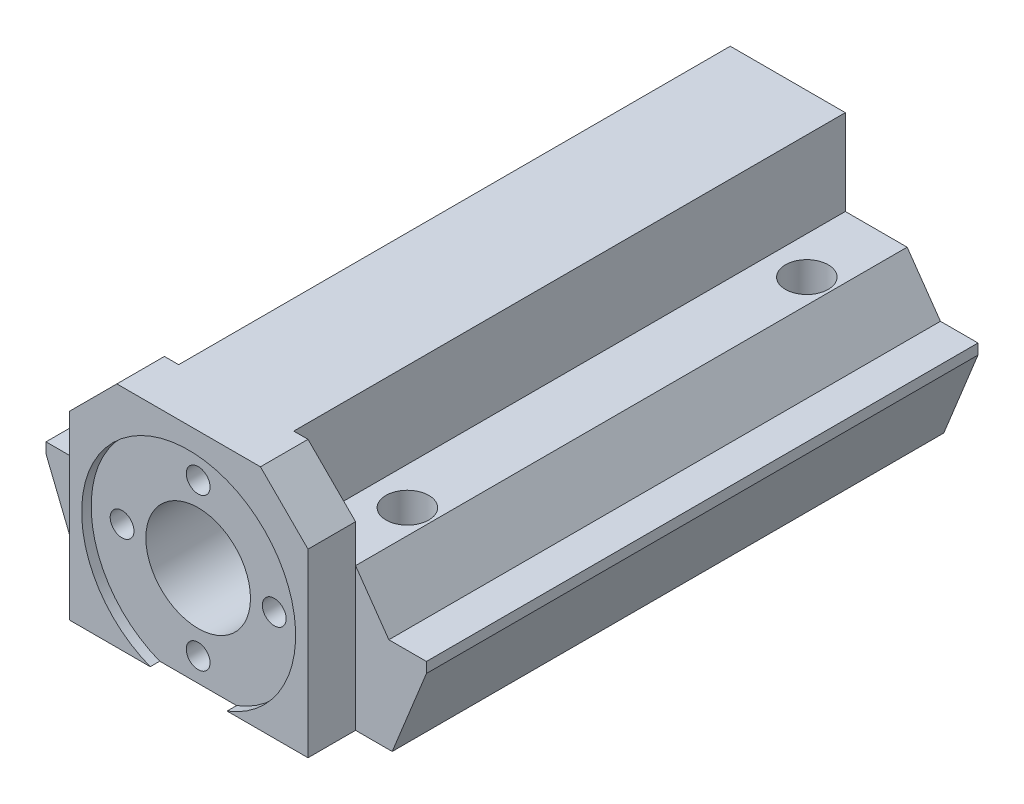
from build123d import *
from OCP.BRepFilletAPI import BRepFilletAPI_MakeChamfer

# Parameters (mm, degrees)
BOSS_EXTRUDE1_DEPTH = 58
SKETCH11_W          = 40
SKETCH11_H          = 11
BOSS_EXTRUDE3_DEPTH = 58
SKETCH5_W           = 25.1
SKETCH5_H           = 25
BOSS_EXTRUDE2_DEPTH = 5
SKETCH6_R           = 5.5
CUT_EXTRUDE4_DEPTH  = 63
SKETCH7_R           = 11.25
CUT_EXTRUDE5_DEPTH  = 1
SKETCH10_R          = 2.25
CUT_EXTRUDE7_DEPTH  = 16
CHAMFER2_SIZE       = 5
SKETCH9_R           = 1.25
CUT_EXTRUDE8_DEPTH  = 10
CUT_EXTRUDE9_DEPTH  = 8
CHAMFER4_SIZE       = 2
CHAMFER6_SIZE       = 5
CHAMFER6_SIZE_2     = 3.501037691
CHAMFER7_SIZE       = 4
CHAMFER7_SIZE2      = 9.900347414
CHAMFER8_SIZE       = 4
CHAMFER8_SIZE2      = 9.900347414
SKETCH13_W          = 40
SKETCH13_H          = 2
CUT_EXTRUDE10_DEPTH = 67


# Some blends are built 0.0001 mm under size
with BuildPart() as part:
    # Sketch1 → Boss-Extrude1 (new body)
    with BuildSketch(Plane.XY):
        Polygon((-6.05, 25), (6.05, 25), (6.05, 16), (12.55, 16), (12.55, 0), (-12.55, 0), (-12.55, 16), (-6.05, 16), align=None)
    extrude(amount=BOSS_EXTRUDE1_DEPTH)

    # Sketch11 → Boss-Extrude3 (add)
    with BuildSketch(Plane(origin=(0, 0, 0), x_dir=(-1, 0, 0), z_dir=(0, 0, -1))):
        with Locations((0, 5.5)):
            Rectangle(SKETCH11_W, SKETCH11_H)
    extrude(amount=-BOSS_EXTRUDE3_DEPTH)

    # Sketch5 → Boss-Extrude2 (add)
    with BuildSketch(Plane.XY.offset(58)):
        with Locations((0, 12.5)):
            Rectangle(SKETCH5_W, SKETCH5_H)
    extrude(amount=BOSS_EXTRUDE2_DEPTH)

    # Sketch6 → Cut-Extrude4 (cut)
    with BuildSketch(Plane(origin=(0, 0, 0), x_dir=(-1, 0, 0), z_dir=(0, 0, -1))):
        with Locations((0, 11.5)):
            Circle(SKETCH6_R)
    extrude(amount=-CUT_EXTRUDE4_DEPTH, mode=Mode.SUBTRACT)

    # Sketch7 → Cut-Extrude5 (cut)
    with BuildSketch(Plane.XY.offset(63)):
        with Locations((0, 11.5)):
            Circle(SKETCH7_R)
    extrude(amount=-CUT_EXTRUDE5_DEPTH, mode=Mode.SUBTRACT)

    # Sketch10 → Cut-Extrude7 (cut)
    with BuildSketch(Plane(origin=(0, 16, 0), x_dir=(1, 0, 0), z_dir=(0, 1, 0))):
        with Locations(Location((-10, -8, 0), (0, 0, 270))):
            Circle(SKETCH10_R)
        with Locations(Location((-10, -50, 0), (0, 0, 270))):
            Circle(SKETCH10_R)
        with Locations(Location((10, -50, 0), (0, 0, 270))):
            Circle(SKETCH10_R)
        with Locations(Location((10, -8, 0), (0, 0, 270))):
            Circle(SKETCH10_R)
    extrude(amount=-CUT_EXTRUDE7_DEPTH, mode=Mode.SUBTRACT)

    # Chamfer2
    chamfer2_edges = [part.edges().sort_by_distance(p)[0] for p in [
        (-12.55, 25, 60.5),
        (12.55, 25, 60.5),
    ]]
    chamfer(chamfer2_edges, length=CHAMFER2_SIZE)

    # Sketch9 → Cut-Extrude8 (cut)
    with BuildSketch(Plane.XY.offset(62)):
        with Locations((-8, 11.5)):
            Circle(SKETCH9_R)
        with Locations((8, 11.5)):
            Circle(SKETCH9_R)
        with Locations((0, 3.5)):
            Circle(SKETCH9_R)
        with Locations((0, 19.5)):
            Circle(SKETCH9_R)
    extrude(amount=-CUT_EXTRUDE8_DEPTH, mode=Mode.SUBTRACT)

    # Sketch12 → Cut-Extrude9 (cut)
    with BuildSketch(Plane.XZ):
        Polygon((12.165063509, 46.25), (14.330127019, 50), (12.165063509, 53.75), (7.834936491, 53.75), (5.669872981, 50), (7.834936491, 46.25), align=None)
        Polygon((-7.834936491, 46.25), (-5.669872981, 50), (-7.834936491, 53.75), (-12.165063509, 53.75), (-14.330127019, 50), (-12.165063509, 46.25), align=None)
        Polygon((-7.834936491, 4.25), (-5.669872981, 8), (-7.834936491, 11.75), (-12.165063509, 11.75), (-14.330127019, 8), (-12.165063509, 4.25), align=None)
        Polygon((12.165063509, 4.25), (14.330127019, 8), (12.165063509, 11.75), (7.834936491, 11.75), (5.669872981, 8), (7.834936491, 4.25), align=None)
    extrude(amount=-CUT_EXTRUDE9_DEPTH, mode=Mode.SUBTRACT)

    # Chamfer4
    # the kernel refuses this chamfer: 2 mm, written as the material it adds along each edge
    with BuildSketch(Plane(origin=(-16.901810007, 8, 12.454285596), x_dir=(-0.023812127644090745, -0.9996219169112968, -0.013747938305293514), z_dir=(0.49999999999999983, 0, -0.8660254037844388))) as chamfer4_piece_1_section:
        Polygon((CHAMFER4_SIZE * 0.999621916911, -CHAMFER4_SIZE * 0.0274958766106), (-CHAMFER4_SIZE * 0.0274958766106, -CHAMFER4_SIZE * 0.999621916911), (0, 0), align=None)
    chamfer4_piece_1 = extrude(amount=14.616858971, mode=Mode.PRIVATE)
    chamfer4_piece_1 = chamfer4_piece_1 - Plane(origin=(-10, 7.348778849, 8), x_dir=(0, 0, 1), z_dir=(0, 1, 0)) * Cylinder(2.25, 38, mode=Mode.PRIVATE)
    chamfer4_piece_1 = split(chamfer4_piece_1, bisect_by=Plane(origin=(-12.643492577, 7.348778849, 4.25), z_dir=(0, 0, 1)), keep=Keep.TOP, mode=Mode.PRIVATE)
    add(chamfer4_piece_1)
    with BuildSketch(Plane(origin=(-9.593380521, 8, 16.204285596), x_dir=(-0.02381212764408972, -0.9996219169112968, 0.013747938305292926), z_dir=(-0.49999999999999994, 0, -0.8660254037844387))) as chamfer4_piece_2_section:
        Polygon((CHAMFER4_SIZE * 0.999621916911, -CHAMFER4_SIZE * 0.0274958766106), (-CHAMFER4_SIZE * 0.0274958766106, -CHAMFER4_SIZE * 0.999621916911), (0, 0), align=None)
    chamfer4_piece_2 = extrude(amount=14.616858971, mode=Mode.PRIVATE)
    chamfer4_piece_2 = chamfer4_piece_2 - Plane(origin=(-10, 7.348778849, 8), x_dir=(0, 0, 1), z_dir=(0, 1, 0)) * Cylinder(2.25, 38, mode=Mode.PRIVATE)
    add(chamfer4_piece_2)
    with BuildSketch(Plane(origin=(-2.691570515, 8, 11.75), x_dir=(0, -0.9996219169112968, 0.027495876610586487), z_dir=(-1, 0, 0))) as chamfer4_piece_3_section:
        Polygon((CHAMFER4_SIZE * 0.999621916911, -CHAMFER4_SIZE * 0.0274958766106), (-CHAMFER4_SIZE * 0.0274958766106, -CHAMFER4_SIZE * 0.999621916911), (0, 0), align=None)
    chamfer4_piece_3 = extrude(amount=14.616858971, mode=Mode.PRIVATE)
    chamfer4_piece_3 = chamfer4_piece_3 - Plane(origin=(-10, 7.348778849, 8), x_dir=(0, 0, 1), z_dir=(0, 1, 0)) * Cylinder(2.25, 38, mode=Mode.PRIVATE)
    chamfer4_piece_3 = split(chamfer4_piece_3, bisect_by=Plane(origin=(-8.074151024, 7.348778849, 12.164331727), z_dir=(-0.8660254037844387, 0, -0.49999999999999994)), keep=Keep.TOP, mode=Mode.PRIVATE)
    add(chamfer4_piece_3)
    with BuildSketch(Plane(origin=(-3.098189993, 8, 3.545714404), x_dir=(0.023812127644090235, -0.9996219169112968, 0.01374793830529322), z_dir=(-0.49999999999999994, 0, 0.8660254037844387))) as chamfer4_piece_4_section:
        Polygon((CHAMFER4_SIZE * 0.999621916911, -CHAMFER4_SIZE * 0.0274958766106), (-CHAMFER4_SIZE * 0.0274958766106, -CHAMFER4_SIZE * 0.999621916911), (0, 0), align=None)
    chamfer4_piece_4 = extrude(amount=14.616858971, mode=Mode.PRIVATE)
    chamfer4_piece_4 = chamfer4_piece_4 - Plane(origin=(-10, 7.348778849, 8), x_dir=(0, 0, 1), z_dir=(0, 1, 0)) * Cylinder(2.25, 38, mode=Mode.PRIVATE)
    chamfer4_piece_4 = split(chamfer4_piece_4, bisect_by=Plane(origin=(-5.430658447, 7.348778849, 8.414331727), z_dir=(-0.8660254037844387, 0, 0.4999999999999999)), keep=Keep.TOP, mode=Mode.PRIVATE)
    add(chamfer4_piece_4)
    with BuildSketch(Plane(origin=(-10.406619479, 8, -0.204285596), x_dir=(0.023812127644089884, -0.9996219169112968, -0.013747938305293021), z_dir=(0.4999999999999999, 0, 0.8660254037844387))) as chamfer4_piece_5_section:
        Polygon((CHAMFER4_SIZE * 0.999621916911, -CHAMFER4_SIZE * 0.0274958766106), (-CHAMFER4_SIZE * 0.0274958766106, -CHAMFER4_SIZE * 0.999621916911), (0, 0), align=None)
    chamfer4_piece_5 = extrude(amount=14.616858971, mode=Mode.PRIVATE)
    chamfer4_piece_5 = chamfer4_piece_5 - Plane(origin=(-10, 7.348778849, 8), x_dir=(0, 0, 1), z_dir=(0, 1, 0)) * Cylinder(2.25, 38, mode=Mode.PRIVATE)
    chamfer4_piece_5 = split(chamfer4_piece_5, bisect_by=Plane(origin=(-5.430658447, 7.348778849, 7.585668273), z_dir=(-0.8660254037844387, 0, -0.49999999999999994)), keep=Keep.TOP, mode=Mode.PRIVATE)
    chamfer4_piece_5 = split(chamfer4_piece_5, bisect_by=Plane(origin=(-7.356507423, 7.348778849, 4.25), z_dir=(0, 0, 1)), keep=Keep.TOP, mode=Mode.PRIVATE)
    add(chamfer4_piece_5)
    with BuildSketch(Plane(origin=(-17.308429485, 8, 4.25), x_dir=(0, -0.9996219169112968, -0.027495876610586487), z_dir=(1, 0, 0))) as chamfer4_piece_6_section:
        Polygon((CHAMFER4_SIZE * 0.999621916911, -CHAMFER4_SIZE * 0.0274958766106), (-CHAMFER4_SIZE * 0.0274958766106, -CHAMFER4_SIZE * 0.999621916911), (0, 0), align=None)
    chamfer4_piece_6 = extrude(amount=14.616858971, mode=Mode.PRIVATE)
    chamfer4_piece_6 = chamfer4_piece_6 - Plane(origin=(-10, 7.348778849, 8), x_dir=(0, 0, 1), z_dir=(0, 1, 0)) * Cylinder(2.25, 38, mode=Mode.PRIVATE)
    chamfer4_piece_6 = split(chamfer4_piece_6, bisect_by=Plane(origin=(-8.074151024, 7.348778849, 3.835668273), z_dir=(-0.8660254037844387, 0, 0.4999999999999999)), keep=Keep.TOP, mode=Mode.PRIVATE)
    add(chamfer4_piece_6)
    with BuildSketch(Plane(origin=(3.098189993, 8, 12.454285596), x_dir=(-0.023812127644090207, -0.9996219169112968, -0.013747938305293207), z_dir=(0.49999999999999994, 0, -0.8660254037844387))) as chamfer4_piece_7_section:
        Polygon((CHAMFER4_SIZE * 0.999621916911, -CHAMFER4_SIZE * 0.0274958766106), (-CHAMFER4_SIZE * 0.0274958766106, -CHAMFER4_SIZE * 0.999621916911), (0, 0), align=None)
    chamfer4_piece_7 = extrude(amount=14.616858971, mode=Mode.PRIVATE)
    chamfer4_piece_7 = split(chamfer4_piece_7, bisect_by=Plane(origin=(5.430658447, 7.348778849, 7.585668273), z_dir=(0.8660254037844387, 0, -0.49999999999999994)), keep=Keep.TOP, mode=Mode.PRIVATE)
    chamfer4_piece_7 = split(chamfer4_piece_7, bisect_by=Plane(origin=(7.356507423, 7.348778849, 4.25), z_dir=(0, 0, 1)), keep=Keep.TOP, mode=Mode.PRIVATE)
    chamfer4_piece_7 = chamfer4_piece_7 - Plane(origin=(10, 7.348778849, 8), x_dir=(0, 0, 1), z_dir=(0, 1, 0)) * Cylinder(2.25, 38, mode=Mode.PRIVATE)
    add(chamfer4_piece_7)
    with BuildSketch(Plane(origin=(10.406619479, 8, 16.204285596), x_dir=(-0.023812127644090367, -0.9996219169112968, 0.0137479383052933), z_dir=(-0.49999999999999994, 0, -0.8660254037844387))) as chamfer4_piece_8_section:
        Polygon((CHAMFER4_SIZE * 0.999621916911, -CHAMFER4_SIZE * 0.0274958766106), (-CHAMFER4_SIZE * 0.0274958766106, -CHAMFER4_SIZE * 0.999621916911), (0, 0), align=None)
    chamfer4_piece_8 = extrude(amount=14.616858971, mode=Mode.PRIVATE)
    chamfer4_piece_8 = split(chamfer4_piece_8, bisect_by=Plane(origin=(5.430658447, 7.348778849, 8.414331727), z_dir=(0.8660254037844387, 0, 0.49999999999999994)), keep=Keep.TOP, mode=Mode.PRIVATE)
    chamfer4_piece_8 = chamfer4_piece_8 - Plane(origin=(10, 7.348778849, 8), x_dir=(0, 0, 1), z_dir=(0, 1, 0)) * Cylinder(2.25, 38, mode=Mode.PRIVATE)
    add(chamfer4_piece_8)
    with BuildSketch(Plane(origin=(17.308429485, 8, 11.75), x_dir=(0, -0.9996219169112968, 0.027495876610586487), z_dir=(-1, 0, 0))) as chamfer4_piece_9_section:
        Polygon((CHAMFER4_SIZE * 0.999621916911, -CHAMFER4_SIZE * 0.0274958766106), (-CHAMFER4_SIZE * 0.0274958766106, -CHAMFER4_SIZE * 0.999621916911), (0, 0), align=None)
    chamfer4_piece_9 = extrude(amount=14.616858971, mode=Mode.PRIVATE)
    chamfer4_piece_9 = split(chamfer4_piece_9, bisect_by=Plane(origin=(8.074151024, 7.348778849, 12.164331727), z_dir=(0.8660254037844387, 0, -0.49999999999999994)), keep=Keep.TOP, mode=Mode.PRIVATE)
    chamfer4_piece_9 = chamfer4_piece_9 - Plane(origin=(10, 7.348778849, 8), x_dir=(0, 0, 1), z_dir=(0, 1, 0)) * Cylinder(2.25, 38, mode=Mode.PRIVATE)
    add(chamfer4_piece_9)
    with BuildSketch(Plane(origin=(16.901810007, 8, 3.545714404), x_dir=(0.02381212764409056, -0.9996219169112968, 0.013747938305293401), z_dir=(-0.49999999999999967, 0, 0.8660254037844388))) as chamfer4_piece_10_section:
        Polygon((CHAMFER4_SIZE * 0.999621916911, -CHAMFER4_SIZE * 0.0274958766106), (-CHAMFER4_SIZE * 0.0274958766106, -CHAMFER4_SIZE * 0.999621916911), (0, 0), align=None)
    chamfer4_piece_10 = extrude(amount=14.616858971, mode=Mode.PRIVATE)
    chamfer4_piece_10 = chamfer4_piece_10 - Plane(origin=(10, 7.348778849, 8), x_dir=(0, 0, 1), z_dir=(0, 1, 0)) * Cylinder(2.25, 38, mode=Mode.PRIVATE)
    add(chamfer4_piece_10)
    with BuildSketch(Plane(origin=(9.593380521, 8, -0.204285596), x_dir=(0.02381212764408988, -0.9996219169112968, -0.01374793830529301), z_dir=(0.49999999999999967, 0, 0.8660254037844388))) as chamfer4_piece_11_section:
        Polygon((CHAMFER4_SIZE * 0.999621916911, -CHAMFER4_SIZE * 0.0274958766106), (-CHAMFER4_SIZE * 0.0274958766106, -CHAMFER4_SIZE * 0.999621916911), (0, 0), align=None)
    chamfer4_piece_11 = extrude(amount=14.616858971, mode=Mode.PRIVATE)
    chamfer4_piece_11 = split(chamfer4_piece_11, bisect_by=Plane(origin=(12.643492577, 7.348778849, 4.25), z_dir=(0, 0, 1)), keep=Keep.TOP, mode=Mode.PRIVATE)
    chamfer4_piece_11 = chamfer4_piece_11 - Plane(origin=(10, 7.348778849, 8), x_dir=(0, 0, 1), z_dir=(0, 1, 0)) * Cylinder(2.25, 38, mode=Mode.PRIVATE)
    add(chamfer4_piece_11)
    with BuildSketch(Plane(origin=(2.691570515, 8, 4.25), x_dir=(0, -0.9996219169112968, -0.027495876610586487), z_dir=(1, 0, 0))) as chamfer4_piece_12_section:
        Polygon((CHAMFER4_SIZE * 0.999621916911, -CHAMFER4_SIZE * 0.0274958766106), (-CHAMFER4_SIZE * 0.0274958766106, -CHAMFER4_SIZE * 0.999621916911), (0, 0), align=None)
    chamfer4_piece_12 = extrude(amount=14.616858971, mode=Mode.PRIVATE)
    chamfer4_piece_12 = split(chamfer4_piece_12, bisect_by=Plane(origin=(8.074151024, 7.348778849, 3.835668273), z_dir=(0.8660254037844387, 0, 0.49999999999999994)), keep=Keep.TOP, mode=Mode.PRIVATE)
    chamfer4_piece_12 = chamfer4_piece_12 - Plane(origin=(10, 7.348778849, 8), x_dir=(0, 0, 1), z_dir=(0, 1, 0)) * Cylinder(2.25, 38, mode=Mode.PRIVATE)
    add(chamfer4_piece_12)
    with BuildSketch(Plane(origin=(3.098189993, 8, 54.454285596), x_dir=(-0.02381212764409011, -0.9996219169112968, -0.013747938305293146), z_dir=(0.4999999999999998, 0, -0.8660254037844388))) as chamfer4_piece_13_section:
        Polygon((CHAMFER4_SIZE * 0.999621916911, -CHAMFER4_SIZE * 0.0274958766106), (-CHAMFER4_SIZE * 0.0274958766106, -CHAMFER4_SIZE * 0.999621916911), (0, 0), align=None)
    chamfer4_piece_13 = extrude(amount=14.616858971, mode=Mode.PRIVATE)
    chamfer4_piece_13 = split(chamfer4_piece_13, bisect_by=Plane(origin=(5.430658447, 7.348778849, 49.585668273), z_dir=(0.8660254037844388, 0, -0.49999999999999967)), keep=Keep.TOP, mode=Mode.PRIVATE)
    chamfer4_piece_13 = chamfer4_piece_13 - Plane(origin=(10, 7.348778849, 50), x_dir=(0, 0, 1), z_dir=(0, 1, 0)) * Cylinder(2.25, 38, mode=Mode.PRIVATE)
    add(chamfer4_piece_13)
    with BuildSketch(Plane(origin=(10.406619479, 8, 58.204285596), x_dir=(-0.023812127644089826, -0.9996219169112968, 0.013747938305292978), z_dir=(-0.4999999999999997, 0, -0.8660254037844389))) as chamfer4_piece_14_section:
        Polygon((CHAMFER4_SIZE * 0.999621916911, -CHAMFER4_SIZE * 0.0274958766106), (-CHAMFER4_SIZE * 0.0274958766106, -CHAMFER4_SIZE * 0.999621916911), (0, 0), align=None)
    chamfer4_piece_14 = extrude(amount=14.616858971, mode=Mode.PRIVATE)
    chamfer4_piece_14 = split(chamfer4_piece_14, bisect_by=Plane(origin=(5.430658447, 7.348778849, 50.414331727), z_dir=(0.8660254037844388, 0, 0.4999999999999998)), keep=Keep.TOP, mode=Mode.PRIVATE)
    chamfer4_piece_14 = chamfer4_piece_14 - Plane(origin=(10, 7.348778849, 50), x_dir=(0, 0, 1), z_dir=(0, 1, 0)) * Cylinder(2.25, 38, mode=Mode.PRIVATE)
    add(chamfer4_piece_14)
    with BuildSketch(Plane(origin=(17.308429485, 8, 53.75), x_dir=(0, -0.9996219169112968, 0.027495876610585623), z_dir=(-1, 0, 0))) as chamfer4_piece_15_section:
        Polygon((CHAMFER4_SIZE * 0.999621916911, -CHAMFER4_SIZE * 0.0274958766106), (-CHAMFER4_SIZE * 0.0274958766106, -CHAMFER4_SIZE * 0.999621916911), (0, 0), align=None)
    chamfer4_piece_15 = extrude(amount=14.616858971, mode=Mode.PRIVATE)
    chamfer4_piece_15 = split(chamfer4_piece_15, bisect_by=Plane(origin=(8.074151024, 7.348778849, 54.164331727), z_dir=(0.8660254037844388, 0, -0.49999999999999967)), keep=Keep.TOP, mode=Mode.PRIVATE)
    chamfer4_piece_15 = chamfer4_piece_15 - Plane(origin=(10, 7.348778849, 50), x_dir=(0, 0, 1), z_dir=(0, 1, 0)) * Cylinder(2.25, 38, mode=Mode.PRIVATE)
    add(chamfer4_piece_15)
    with BuildSketch(Plane(origin=(16.901810007, 8, 45.545714404), x_dir=(0.023812127644090925, -0.9996219169112968, 0.013747938305293602), z_dir=(-0.49999999999999944, 0, 0.866025403784439))) as chamfer4_piece_16_section:
        Polygon((CHAMFER4_SIZE * 0.999621916911, -CHAMFER4_SIZE * 0.0274958766106), (-CHAMFER4_SIZE * 0.0274958766106, -CHAMFER4_SIZE * 0.999621916911), (0, 0), align=None)
    chamfer4_piece_16 = extrude(amount=14.616858971, mode=Mode.PRIVATE)
    chamfer4_piece_16 = chamfer4_piece_16 - Plane(origin=(10, 7.348778849, 50), x_dir=(0, 0, 1), z_dir=(0, 1, 0)) * Cylinder(2.25, 38, mode=Mode.PRIVATE)
    add(chamfer4_piece_16)
    with BuildSketch(Plane(origin=(9.593380521, 8, 41.795714404), x_dir=(0.023812127644090273, -0.9996219169112968, -0.013747938305293236), z_dir=(0.49999999999999967, 0, 0.8660254037844388))) as chamfer4_piece_17_section:
        Polygon((CHAMFER4_SIZE * 0.999621916911, -CHAMFER4_SIZE * 0.0274958766106), (-CHAMFER4_SIZE * 0.0274958766106, -CHAMFER4_SIZE * 0.999621916911), (0, 0), align=None)
    chamfer4_piece_17 = extrude(amount=14.616858971, mode=Mode.PRIVATE)
    chamfer4_piece_17 = chamfer4_piece_17 - Plane(origin=(10, 7.348778849, 50), x_dir=(0, 0, 1), z_dir=(0, 1, 0)) * Cylinder(2.25, 38, mode=Mode.PRIVATE)
    add(chamfer4_piece_17)
    with BuildSketch(Plane(origin=(2.691570515, 8, 46.25), x_dir=(0, -0.9996219169112968, -0.027495876610585623), z_dir=(1, 0, 0))) as chamfer4_piece_18_section:
        Polygon((CHAMFER4_SIZE * 0.999621916911, -CHAMFER4_SIZE * 0.0274958766106), (-CHAMFER4_SIZE * 0.0274958766106, -CHAMFER4_SIZE * 0.999621916911), (0, 0), align=None)
    chamfer4_piece_18 = extrude(amount=14.616858971, mode=Mode.PRIVATE)
    chamfer4_piece_18 = split(chamfer4_piece_18, bisect_by=Plane(origin=(8.074151024, 7.348778849, 45.835668273), z_dir=(0.8660254037844388, 0, 0.4999999999999998)), keep=Keep.TOP, mode=Mode.PRIVATE)
    chamfer4_piece_18 = chamfer4_piece_18 - Plane(origin=(10, 7.348778849, 50), x_dir=(0, 0, 1), z_dir=(0, 1, 0)) * Cylinder(2.25, 38, mode=Mode.PRIVATE)
    add(chamfer4_piece_18)
    with BuildSketch(Plane(origin=(-16.901810007, 8, 54.454285596), x_dir=(-0.023812127644091113, -0.9996219169112968, -0.013747938305293738), z_dir=(0.5000000000000001, 0, -0.8660254037844387))) as chamfer4_piece_19_section:
        Polygon((CHAMFER4_SIZE * 0.999621916911, -CHAMFER4_SIZE * 0.0274958766106), (-CHAMFER4_SIZE * 0.0274958766106, -CHAMFER4_SIZE * 0.999621916911), (0, 0), align=None)
    chamfer4_piece_19 = extrude(amount=14.616858971, mode=Mode.PRIVATE)
    chamfer4_piece_19 = chamfer4_piece_19 - Plane(origin=(-10, 7.348778849, 50), x_dir=(0, 0, 1), z_dir=(0, 1, 0)) * Cylinder(2.25, 38, mode=Mode.PRIVATE)
    add(chamfer4_piece_19)
    with BuildSketch(Plane(origin=(-9.593380521, 8, 58.204285596), x_dir=(-0.023812127644089826, -0.9996219169112968, 0.013747938305292976), z_dir=(-0.4999999999999996, 0, -0.8660254037844389))) as chamfer4_piece_20_section:
        Polygon((CHAMFER4_SIZE * 0.999621916911, -CHAMFER4_SIZE * 0.0274958766106), (-CHAMFER4_SIZE * 0.0274958766106, -CHAMFER4_SIZE * 0.999621916911), (0, 0), align=None)
    chamfer4_piece_20 = extrude(amount=14.616858971, mode=Mode.PRIVATE)
    chamfer4_piece_20 = chamfer4_piece_20 - Plane(origin=(-10, 7.348778849, 50), x_dir=(0, 0, 1), z_dir=(0, 1, 0)) * Cylinder(2.25, 38, mode=Mode.PRIVATE)
    add(chamfer4_piece_20)
    with BuildSketch(Plane(origin=(-2.691570515, 8, 53.75), x_dir=(0, -0.9996219169112968, 0.027495876610585623), z_dir=(-1, 0, 0))) as chamfer4_piece_21_section:
        Polygon((CHAMFER4_SIZE * 0.999621916911, -CHAMFER4_SIZE * 0.0274958766106), (-CHAMFER4_SIZE * 0.0274958766106, -CHAMFER4_SIZE * 0.999621916911), (0, 0), align=None)
    chamfer4_piece_21 = extrude(amount=14.616858971, mode=Mode.PRIVATE)
    chamfer4_piece_21 = chamfer4_piece_21 - Plane(origin=(-10, 7.348778849, 50), x_dir=(0, 0, 1), z_dir=(0, 1, 0)) * Cylinder(2.25, 38, mode=Mode.PRIVATE)
    chamfer4_piece_21 = split(chamfer4_piece_21, bisect_by=Plane(origin=(-8.074151024, 7.348778849, 54.164331727), z_dir=(-0.866025403784439, 0, -0.49999999999999944)), keep=Keep.TOP, mode=Mode.PRIVATE)
    add(chamfer4_piece_21)
    with BuildSketch(Plane(origin=(-3.098189993, 8, 45.545714404), x_dir=(0.023812127644091286, -0.9996219169112968, 0.01374793830529381), z_dir=(-0.49999999999999944, 0, 0.866025403784439))) as chamfer4_piece_22_section:
        Polygon((CHAMFER4_SIZE * 0.999621916911, -CHAMFER4_SIZE * 0.0274958766106), (-CHAMFER4_SIZE * 0.0274958766106, -CHAMFER4_SIZE * 0.999621916911), (0, 0), align=None)
    chamfer4_piece_22 = extrude(amount=14.616858971, mode=Mode.PRIVATE)
    chamfer4_piece_22 = chamfer4_piece_22 - Plane(origin=(-10, 7.348778849, 50), x_dir=(0, 0, 1), z_dir=(0, 1, 0)) * Cylinder(2.25, 38, mode=Mode.PRIVATE)
    chamfer4_piece_22 = split(chamfer4_piece_22, bisect_by=Plane(origin=(-5.430658447, 7.348778849, 50.414331727), z_dir=(-0.8660254037844384, 0, 0.5000000000000006)), keep=Keep.TOP, mode=Mode.PRIVATE)
    add(chamfer4_piece_22)
    with BuildSketch(Plane(origin=(-10.406619479, 8, 41.795714404), x_dir=(0.02381212764408981, -0.9996219169112968, -0.013747938305293002), z_dir=(0.5000000000000006, 0, 0.8660254037844384))) as chamfer4_piece_23_section:
        Polygon((CHAMFER4_SIZE * 0.999621916911, -CHAMFER4_SIZE * 0.0274958766106), (-CHAMFER4_SIZE * 0.0274958766106, -CHAMFER4_SIZE * 0.999621916911), (0, 0), align=None)
    chamfer4_piece_23 = extrude(amount=14.616858971, mode=Mode.PRIVATE)
    chamfer4_piece_23 = chamfer4_piece_23 - Plane(origin=(-10, 7.348778849, 50), x_dir=(0, 0, 1), z_dir=(0, 1, 0)) * Cylinder(2.25, 38, mode=Mode.PRIVATE)
    chamfer4_piece_23 = split(chamfer4_piece_23, bisect_by=Plane(origin=(-5.430658447, 7.348778849, 49.585668273), z_dir=(-0.866025403784439, 0, -0.49999999999999944)), keep=Keep.TOP, mode=Mode.PRIVATE)
    add(chamfer4_piece_23)
    with BuildSketch(Plane(origin=(-17.308429485, 8, 46.25), x_dir=(0, -0.9996219169112968, -0.027495876610585623), z_dir=(1, 0, 0))) as chamfer4_piece_24_section:
        Polygon((CHAMFER4_SIZE * 0.999621916911, -CHAMFER4_SIZE * 0.0274958766106), (-CHAMFER4_SIZE * 0.0274958766106, -CHAMFER4_SIZE * 0.999621916911), (0, 0), align=None)
    chamfer4_piece_24 = extrude(amount=14.616858971, mode=Mode.PRIVATE)
    chamfer4_piece_24 = chamfer4_piece_24 - Plane(origin=(-10, 7.348778849, 50), x_dir=(0, 0, 1), z_dir=(0, 1, 0)) * Cylinder(2.25, 38, mode=Mode.PRIVATE)
    chamfer4_piece_24 = split(chamfer4_piece_24, bisect_by=Plane(origin=(-8.074151024, 7.348778849, 45.835668273), z_dir=(-0.8660254037844384, 0, 0.5000000000000006)), keep=Keep.TOP, mode=Mode.PRIVATE)
    add(chamfer4_piece_24)

    # Chamfer6
    chamfer6_edges_1 = [part.edges().sort_by_distance(p)[0] for p in [
        (-12.55, 11, 29),
    ]]
    chamfer6_side_1 = [part.faces().sort_by_distance(p)[0] for p in [
        (-12.55, 11.070020754, 29),
    ]]
    chamfer6_edges_2 = [part.edges().sort_by_distance(p)[0] for p in [
        (12.55, 11, 29),
    ]]
    chamfer6_side_2 = [part.faces().sort_by_distance(p)[0] for p in [
        (12.55, 11.070020754, 29),
    ]]
    chamfer6 = BRepFilletAPI_MakeChamfer(part.part.solid().wrapped)
    for e in chamfer6_edges_1:
        chamfer6.Add(CHAMFER6_SIZE - 0.0001, CHAMFER6_SIZE_2 - 0.0001, e.wrapped, chamfer6_side_1[0].wrapped)
    for e in chamfer6_edges_2:
        chamfer6.Add(CHAMFER6_SIZE - 0.0001, CHAMFER6_SIZE_2 - 0.0001, e.wrapped, chamfer6_side_2[0].wrapped)
    add(Compound.cast(chamfer6.Shape()), mode=Mode.REPLACE)  # a hair under: the kernel refuses the full size

    # Chamfer7
    chamfer7_edges = [part.edges().sort_by_distance(p)[0] for p in [
        (-20, 0, 29),
    ]]
    chamfer7_side = [part.faces().sort_by_distance(p)[0] for p in [
        (0, 0, 30.75649703),
    ]]
    chamfer(chamfer7_edges, length=CHAMFER7_SIZE, length2=CHAMFER7_SIZE2, reference=chamfer7_side[0])

    # Chamfer8
    chamfer8_edges = [part.edges().sort_by_distance(p)[0] for p in [
        (20, 0, 29),
    ]]
    chamfer8_side = [part.faces().sort_by_distance(p)[0] for p in [
        (2.068715144, 0, 30.958368808),
    ]]
    chamfer(chamfer8_edges, length=CHAMFER8_SIZE, length2=CHAMFER8_SIZE2, reference=chamfer8_side[0])

    # Sketch13 → Cut-Extrude10 (cut)
    with BuildSketch(Plane(origin=(0, 0, 0), x_dir=(-1, 0, 0), z_dir=(0, 0, -1))):
        Rectangle(SKETCH13_W, SKETCH13_H)
    extrude(amount=-CUT_EXTRUDE10_DEPTH, mode=Mode.SUBTRACT)


solid = part.part
